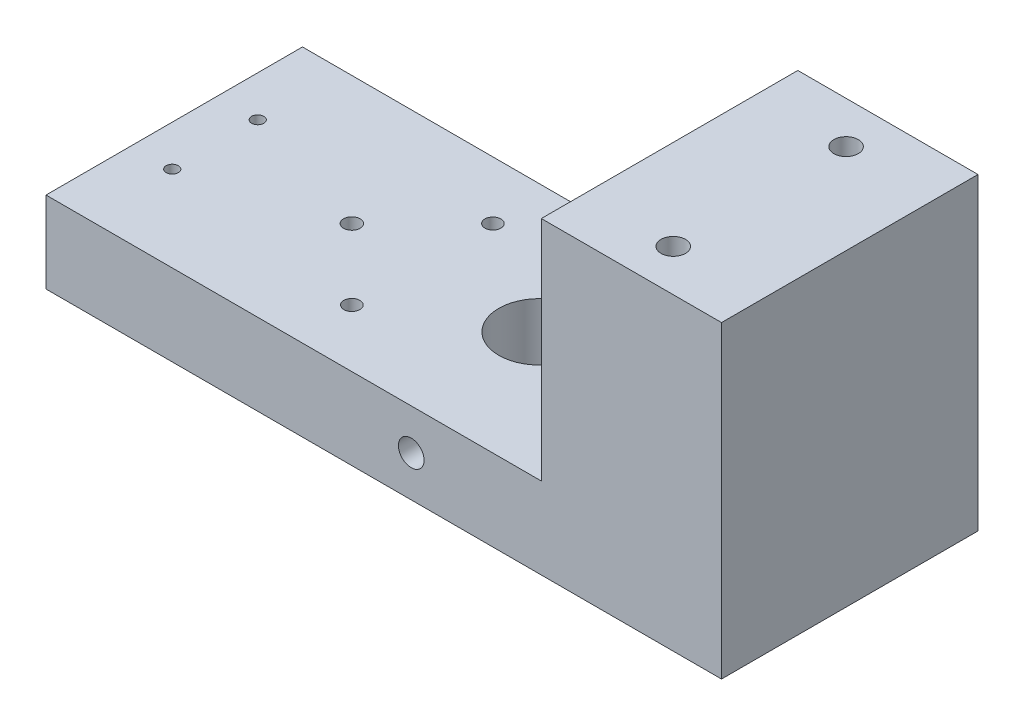
from build123d import *

# Parameters (mm, degrees)
SKETCH2_W                = 40
SKETCH2_H                = 12.7
BOSS_EXTRUDE1_DEPTH      = 105.35
SKETCH4_R                = 6.35
CUT_EXTRUDE1_DEPTH       = 110.75270976
F_4_0_4_DIAMETER_HOLE1_D = 4
SKETCH9_R                = 1.291519898
SKETCH9_R_2              = 1.25
CUT_EXTRUDE3_DEPTH       = 110.752709797
SKETCH14_W               = 28.1
SKETCH14_H               = 40
BOSS_EXTRUDE3_DEPTH      = 35.45
SKETCH10_R               = 3.75
CUT_EXTRUDE4_DEPTH       = 24.5
SKETCH15_R               = 1.905
CUT_EXTRUDE7_DEPTH       = 112.734584217
SKETCH17_R               = 0.95
CUT_EXTRUDE8_DEPTH       = 21


with BuildPart() as part:
    # Sketch2 → Boss-Extrude1 (new body)
    with BuildSketch(Plane(origin=(0, 0, 0), x_dir=(0, 0, -1), z_dir=(1, 0, 0))):
        with Locations((-8.031139822, -4.466363736)):
            Rectangle(SKETCH2_W, SKETCH2_H)
    extrude(amount=BOSS_EXTRUDE1_DEPTH)

    # Sketch4 → Cut-Extrude1 (cut, through all)
    with BuildSketch(Plane(origin=(0, 1.883636264, 0), x_dir=(1, 0, 0), z_dir=(0, 1, 0))):
        with Locations((56.96, -8.031139822)):
            Circle(SKETCH4_R)
    extrude(amount=-CUT_EXTRUDE1_DEPTH, mode=Mode.SUBTRACT)

    # Ø4.0 (4) Diameter Hole1 (through all)
    with Locations(Plane.XY.offset(28.031139822)):
        with Locations((56.96, -4.466363736)):
            Hole(F_4_0_4_DIAMETER_HOLE1_D / 2)

    # Sketch9 → Cut-Extrude3 (cut, through all)
    with BuildSketch(Plane(origin=(0, 1.883636264, 0), x_dir=(1, 0, 0), z_dir=(0, 1, 0))):
        with Locations((27.7, -8.031139822)):
            Circle(SKETCH9_R)
        with Locations((38.7, 2.968860178)):
            Circle(SKETCH9_R_2)
        with Locations((38.7, -19.031139822)):
            Circle(SKETCH9_R_2)
    extrude(amount=-CUT_EXTRUDE3_DEPTH, mode=Mode.SUBTRACT)

    # Sketch14 → Boss-Extrude3 (add)
    with BuildSketch(Plane(origin=(0, 1.883636264, 0), x_dir=(1, 0, 0), z_dir=(0, 1, 0))):
        with Locations((91.3, -8.031139822)):
            Rectangle(SKETCH14_W, SKETCH14_H)
    extrude(amount=BOSS_EXTRUDE3_DEPTH)

    # Sketch10 → Cut-Extrude4 (cut)
    with BuildSketch(Plane(origin=(0, -10.816363736, 0), x_dir=(1, 0, 0), z_dir=(0, 1, 0))):
        with Locations((91.3, -21.505839822)):
            Circle(SKETCH10_R)
        with Locations((91.3, 5.443560178)):
            Circle(SKETCH10_R)
    extrude(amount=CUT_EXTRUDE4_DEPTH, mode=Mode.SUBTRACT)

    # Sketch15 → Cut-Extrude7 (cut, through all)
    with BuildSketch(Plane.XZ.offset(-13.683636264)):
        with Locations((91.3, -5.443560178)):
            Circle(SKETCH15_R)
        with Locations((91.3, 21.505839822)):
            Circle(SKETCH15_R)
    extrude(amount=-CUT_EXTRUDE7_DEPTH, mode=Mode.SUBTRACT)

    # Sketch17 → Cut-Extrude8 (cut)
    with BuildSketch(Plane.XZ.offset(10.816363736)):
        with Locations((6.35, 14.698139822)):
            Circle(SKETCH17_R)
        with Locations((6.35, 1.364139822)):
            Circle(SKETCH17_R)
    extrude(amount=-CUT_EXTRUDE8_DEPTH, mode=Mode.SUBTRACT)


solid = part.part
